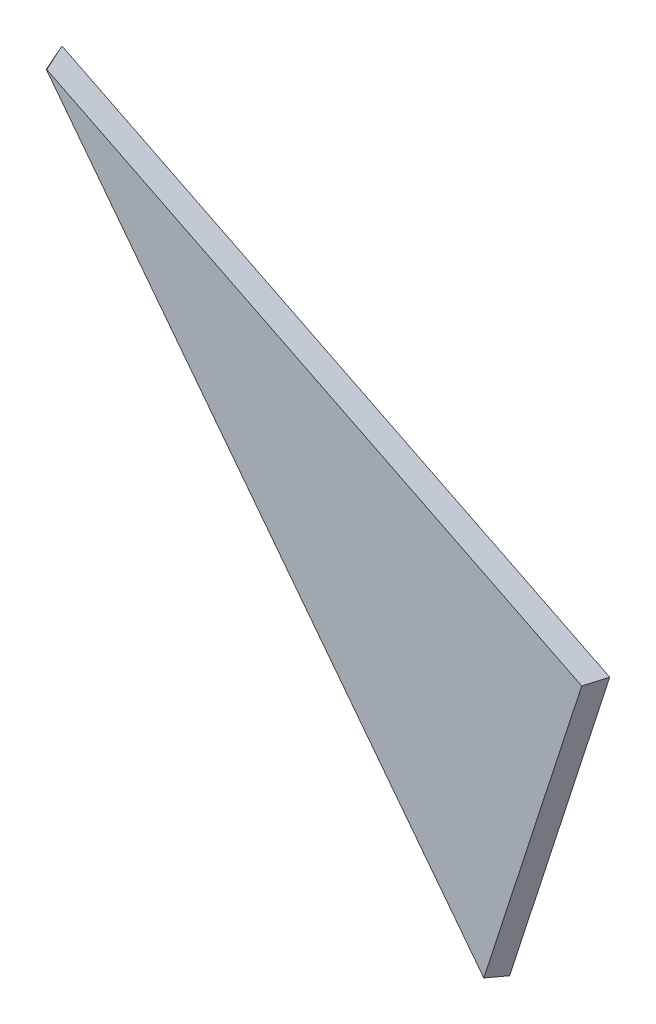
from build123d import *

# Parameters (mm, degrees)
EXTRUDE_1_DEPTH    = 60
CHAMFER3_SIZE2     = 11.912970931
CHAMFER3_SIZE      = 60
CHAMFER4_SIZE2     = 11.912970931
CHAMFER4_SIZE      = 60
CHAMFER5_SIZE2     = 9.519169095
CHAMFER5_SIZE      = 60
CUT_EXTRUDE2_DEPTH = 2201.39802191


with BuildPart() as part:
    # Эскиз1 → Бобышка-Вытянуть1 (new body)
    with BuildSketch(Plane.XY):
        Polygon((-849.589927609, 515.838957491), (787.506047005, 606.405063543), (281.615569427, -953.197537878), align=None)
    extrude(amount=EXTRUDE_1_DEPTH)

    # Chamfer3
    chamfer3_edges = [part.edges().sort_by_distance(p)[0] for p in [
        (-31.041940302, 561.122010517, 60),
    ]]
    chamfer3_side = [part.faces().sort_by_distance(p)[0] for p in [
        (-31.041940302, 561.122010517, 59.761740581),
    ]]
    chamfer(chamfer3_edges, length=CHAMFER3_SIZE - 0.0001, length2=CHAMFER3_SIZE2 - 0.0001, reference=chamfer3_side[0])  # a hair under: the kernel refuses the full size

    # Chamfer4
    chamfer4_edges = [part.edges().sort_by_distance(p)[0] for p in [
        (532.590398399, -179.470785737, 60),
    ]]
    chamfer4_side = [part.faces().sort_by_distance(p)[0] for p in [
        (532.590398399, -179.470785737, 59.761740581),
    ]]
    chamfer(chamfer4_edges, length=CHAMFER4_SIZE - 0.0001, length2=CHAMFER4_SIZE2 - 0.0001, reference=chamfer4_side[0])  # a hair under: the kernel refuses the full size

    # Chamfer5
    chamfer5_edges = [part.edges().sort_by_distance(p)[0] for p in [
        (-283.987179091, -218.679290193, 60),
    ]]
    chamfer5_side = [part.faces().sort_by_distance(p)[0] for p in [
        (-283.987179091, -218.679290193, 59.809616618),
    ]]
    chamfer(chamfer5_edges, length=CHAMFER5_SIZE - 0.0001, length2=CHAMFER5_SIZE2 - 0.0001, reference=chamfer5_side[0])  # a hair under: the kernel refuses the full size

    # 3DSketch1 → Cut-Extrude2 (cut, through all)
    with BuildSketch(Plane(origin=(-849.589927609, 515.838957491, 0), x_dir=(0.9984732860919079, 0.05523673560980175, 0), z_dir=(0, 0, -1))):
        Polygon((0, 0), (1343.966431425, 764.63889794), (1639.599173476, 0), align=None)
    extrude(amount=-CUT_EXTRUDE2_DEPTH, mode=Mode.SUBTRACT)


solid = part.part
